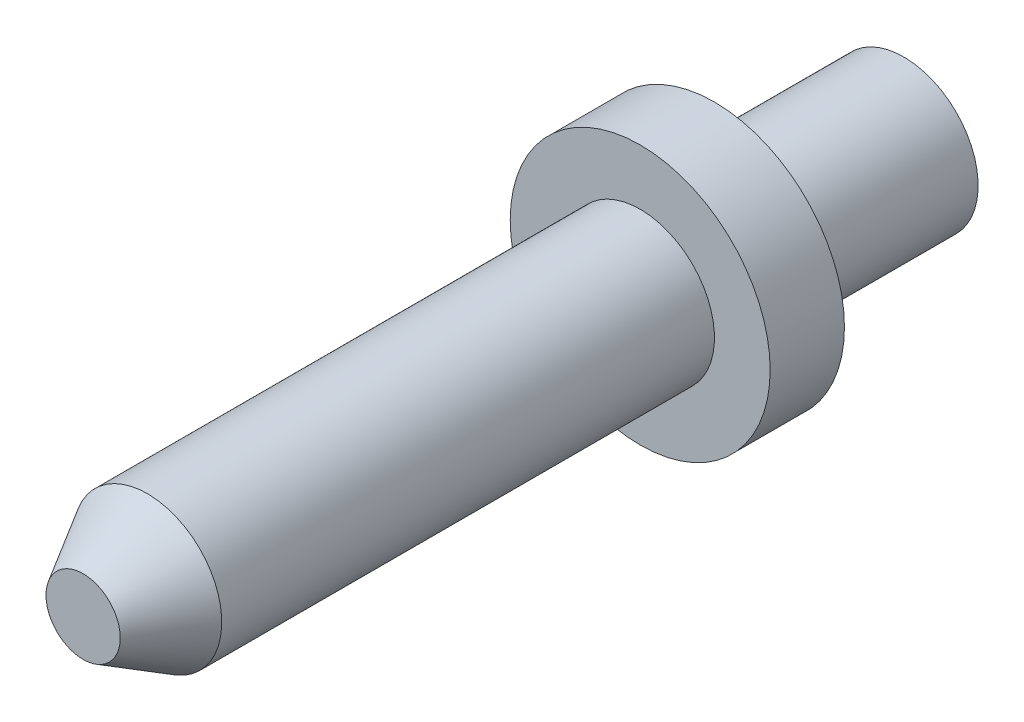
from build123d import *


with BuildPart() as part:
    # Sketch1 → Revolve1 (revolve)
    with BuildSketch(Plane(origin=(0, 0, 0), x_dir=(1, 0, 0), z_dir=(0, 1, 0))):
        Polygon((0, -2.107890205), (0.254, -2.107890205), (0.508, -1.6679493), (0.508, 1.702109795), (0.889, 1.702109795), (0.889, 2.210109795), (0.508, 2.210109795), (0.508, 3.505509795), (0.3175, 3.505509795), (0.3175, 2.489509795), (0, 2.32069205), align=None)
    revolve(axis=Axis((0, 0, -1.702109795), (0, 0, 1)))


solid = part.part
